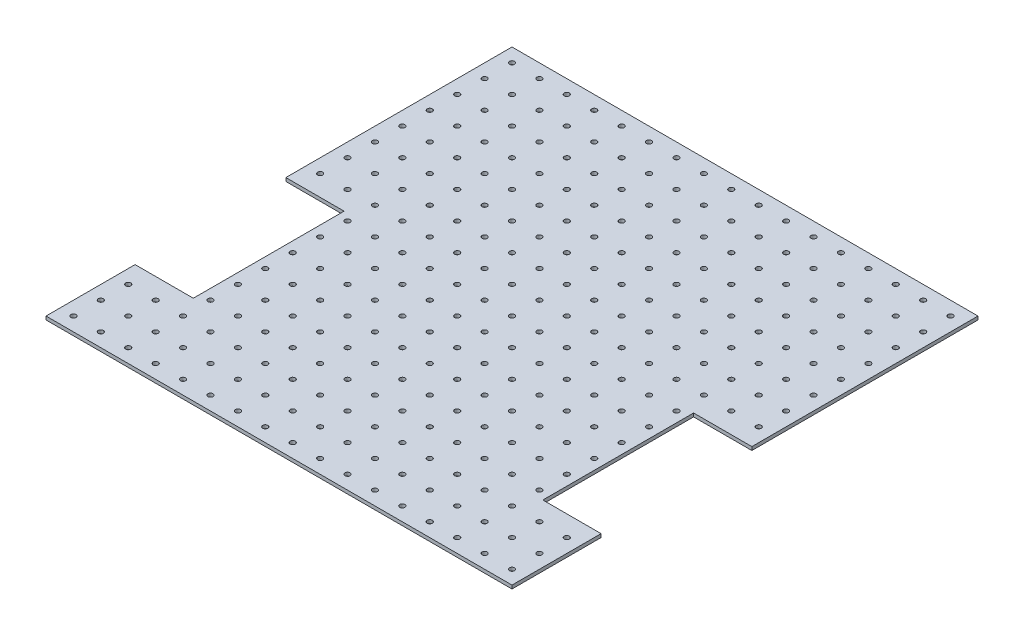
from build123d import *

# Parameters (mm, degrees)
SKETCH1_W           = 431.8
SKETCH1_H           = 431.8
BOSS_EXTRUDE1_DEPTH = 3.175
SKETCH2_R           = 2.38125
CUT_EXTRUDE1_DEPTH  = 3.175
SKETCH3_W           = 107.95
SKETCH3_H           = 139.7
CUT_EXTRUDE2_DEPTH  = 306.345215494


with BuildPart() as part:
    # Sketch1 → Boss-Extrude1 (new body)
    with BuildSketch(Plane(origin=(0, 0, 0), x_dir=(1, 0, 0), z_dir=(0, 1, 0))):
        Rectangle(SKETCH1_W, SKETCH1_H)
    extrude(amount=BOSS_EXTRUDE1_DEPTH)

    # Sketch2 → Cut-Extrude1 (cut)
    with BuildSketch(Plane(origin=(0, 3.175, 0), x_dir=(1, 0, 0), z_dir=(0, 1, 0))):
        with Locations((-203.2, -203.2)):
            Circle(SKETCH2_R)
        with Locations((-177.8, -203.2)):
            Circle(SKETCH2_R)
        with Locations((-152.4, -203.2)):
            Circle(SKETCH2_R)
        with Locations((-127, -203.2)):
            Circle(SKETCH2_R)
        with Locations((-101.6, -203.2)):
            Circle(SKETCH2_R)
        with Locations((-76.2, -203.2)):
            Circle(SKETCH2_R)
        with Locations((-50.8, -203.2)):
            Circle(SKETCH2_R)
        with Locations((-25.4, -203.2)):
            Circle(SKETCH2_R)
        with Locations((0, -203.2)):
            Circle(SKETCH2_R)
        with Locations((25.4, -203.2)):
            Circle(SKETCH2_R)
        with Locations((50.8, -203.2)):
            Circle(SKETCH2_R)
        with Locations((76.2, -203.2)):
            Circle(SKETCH2_R)
        with Locations((101.6, -203.2)):
            Circle(SKETCH2_R)
        with Locations((127, -203.2)):
            Circle(SKETCH2_R)
        with Locations((152.4, -203.2)):
            Circle(SKETCH2_R)
        with Locations((177.8, -203.2)):
            Circle(SKETCH2_R)
        with Locations((-177.8, -177.8)):
            Circle(SKETCH2_R)
        with Locations((-152.4, -177.8)):
            Circle(SKETCH2_R)
        with Locations((-127, -177.8)):
            Circle(SKETCH2_R)
        with Locations((-101.6, -177.8)):
            Circle(SKETCH2_R)
        with Locations((-76.2, -177.8)):
            Circle(SKETCH2_R)
        with Locations((-50.8, -177.8)):
            Circle(SKETCH2_R)
        with Locations((-25.4, -177.8)):
            Circle(SKETCH2_R)
        with Locations((0, -177.8)):
            Circle(SKETCH2_R)
        with Locations((25.4, -177.8)):
            Circle(SKETCH2_R)
        with Locations((50.8, -177.8)):
            Circle(SKETCH2_R)
        with Locations((76.2, -177.8)):
            Circle(SKETCH2_R)
        with Locations((101.6, -177.8)):
            Circle(SKETCH2_R)
        with Locations((127, -177.8)):
            Circle(SKETCH2_R)
        with Locations((152.4, -177.8)):
            Circle(SKETCH2_R)
        with Locations((177.8, -177.8)):
            Circle(SKETCH2_R)
        with Locations((-177.8, -152.4)):
            Circle(SKETCH2_R)
        with Locations((-152.4, -152.4)):
            Circle(SKETCH2_R)
        with Locations((-127, -152.4)):
            Circle(SKETCH2_R)
        with Locations((-101.6, -152.4)):
            Circle(SKETCH2_R)
        with Locations((-76.2, -152.4)):
            Circle(SKETCH2_R)
        with Locations((-50.8, -152.4)):
            Circle(SKETCH2_R)
        with Locations((-25.4, -152.4)):
            Circle(SKETCH2_R)
        with Locations((0, -152.4)):
            Circle(SKETCH2_R)
        with Locations((25.4, -152.4)):
            Circle(SKETCH2_R)
        with Locations((50.8, -152.4)):
            Circle(SKETCH2_R)
        with Locations((76.2, -152.4)):
            Circle(SKETCH2_R)
        with Locations((101.6, -152.4)):
            Circle(SKETCH2_R)
        with Locations((127, -152.4)):
            Circle(SKETCH2_R)
        with Locations((152.4, -152.4)):
            Circle(SKETCH2_R)
        with Locations((177.8, -152.4)):
            Circle(SKETCH2_R)
        with Locations((-177.8, -127)):
            Circle(SKETCH2_R)
        with Locations((-152.4, -127)):
            Circle(SKETCH2_R)
        with Locations((-127, -127)):
            Circle(SKETCH2_R)
        with Locations((-101.6, -127)):
            Circle(SKETCH2_R)
        with Locations((-76.2, -127)):
            Circle(SKETCH2_R)
        with Locations((-50.8, -127)):
            Circle(SKETCH2_R)
        with Locations((-25.4, -127)):
            Circle(SKETCH2_R)
        with Locations((0, -127)):
            Circle(SKETCH2_R)
        with Locations((25.4, -127)):
            Circle(SKETCH2_R)
        with Locations((50.8, -127)):
            Circle(SKETCH2_R)
        with Locations((76.2, -127)):
            Circle(SKETCH2_R)
        with Locations((101.6, -127)):
            Circle(SKETCH2_R)
        with Locations((127, -127)):
            Circle(SKETCH2_R)
        with Locations((152.4, -127)):
            Circle(SKETCH2_R)
        with Locations((177.8, -127)):
            Circle(SKETCH2_R)
        with Locations((-177.8, -101.6)):
            Circle(SKETCH2_R)
        with Locations((-152.4, -101.6)):
            Circle(SKETCH2_R)
        with Locations((-127, -101.6)):
            Circle(SKETCH2_R)
        with Locations((-101.6, -101.6)):
            Circle(SKETCH2_R)
        with Locations((-76.2, -101.6)):
            Circle(SKETCH2_R)
        with Locations((-50.8, -101.6)):
            Circle(SKETCH2_R)
        with Locations((-25.4, -101.6)):
            Circle(SKETCH2_R)
        with Locations((0, -101.6)):
            Circle(SKETCH2_R)
        with Locations((25.4, -101.6)):
            Circle(SKETCH2_R)
        with Locations((50.8, -101.6)):
            Circle(SKETCH2_R)
        with Locations((76.2, -101.6)):
            Circle(SKETCH2_R)
        with Locations((101.6, -101.6)):
            Circle(SKETCH2_R)
        with Locations((127, -101.6)):
            Circle(SKETCH2_R)
        with Locations((152.4, -101.6)):
            Circle(SKETCH2_R)
        with Locations((177.8, -101.6)):
            Circle(SKETCH2_R)
        with Locations((-177.8, -76.2)):
            Circle(SKETCH2_R)
        with Locations((-152.4, -76.2)):
            Circle(SKETCH2_R)
        with Locations((-127, -76.2)):
            Circle(SKETCH2_R)
        with Locations((-101.6, -76.2)):
            Circle(SKETCH2_R)
        with Locations((-76.2, -76.2)):
            Circle(SKETCH2_R)
        with Locations((-50.8, -76.2)):
            Circle(SKETCH2_R)
        with Locations((-25.4, -76.2)):
            Circle(SKETCH2_R)
        with Locations((0, -76.2)):
            Circle(SKETCH2_R)
        with Locations((25.4, -76.2)):
            Circle(SKETCH2_R)
        with Locations((50.8, -76.2)):
            Circle(SKETCH2_R)
        with Locations((76.2, -76.2)):
            Circle(SKETCH2_R)
        with Locations((101.6, -76.2)):
            Circle(SKETCH2_R)
        with Locations((127, -76.2)):
            Circle(SKETCH2_R)
        with Locations((152.4, -76.2)):
            Circle(SKETCH2_R)
        with Locations((177.8, -76.2)):
            Circle(SKETCH2_R)
        with Locations((-177.8, -50.8)):
            Circle(SKETCH2_R)
        with Locations((-152.4, -50.8)):
            Circle(SKETCH2_R)
        with Locations((-127, -50.8)):
            Circle(SKETCH2_R)
        with Locations((-101.6, -50.8)):
            Circle(SKETCH2_R)
        with Locations((-76.2, -50.8)):
            Circle(SKETCH2_R)
        with Locations((-50.8, -50.8)):
            Circle(SKETCH2_R)
        with Locations((-25.4, -50.8)):
            Circle(SKETCH2_R)
        with Locations((0, -50.8)):
            Circle(SKETCH2_R)
        with Locations((25.4, -50.8)):
            Circle(SKETCH2_R)
        with Locations((50.8, -50.8)):
            Circle(SKETCH2_R)
        with Locations((76.2, -50.8)):
            Circle(SKETCH2_R)
        with Locations((101.6, -50.8)):
            Circle(SKETCH2_R)
        with Locations((127, -50.8)):
            Circle(SKETCH2_R)
        with Locations((152.4, -50.8)):
            Circle(SKETCH2_R)
        with Locations((177.8, -50.8)):
            Circle(SKETCH2_R)
        with Locations((-177.8, -25.4)):
            Circle(SKETCH2_R)
        with Locations((-152.4, -25.4)):
            Circle(SKETCH2_R)
        with Locations((-127, -25.4)):
            Circle(SKETCH2_R)
        with Locations((-101.6, -25.4)):
            Circle(SKETCH2_R)
        with Locations((-76.2, -25.4)):
            Circle(SKETCH2_R)
        with Locations((-50.8, -25.4)):
            Circle(SKETCH2_R)
        with Locations((-25.4, -25.4)):
            Circle(SKETCH2_R)
        with Locations((0, -25.4)):
            Circle(SKETCH2_R)
        with Locations((25.4, -25.4)):
            Circle(SKETCH2_R)
        with Locations((50.8, -25.4)):
            Circle(SKETCH2_R)
        with Locations((76.2, -25.4)):
            Circle(SKETCH2_R)
        with Locations((101.6, -25.4)):
            Circle(SKETCH2_R)
        with Locations((127, -25.4)):
            Circle(SKETCH2_R)
        with Locations((152.4, -25.4)):
            Circle(SKETCH2_R)
        with Locations((177.8, -25.4)):
            Circle(SKETCH2_R)
        with Locations((-177.8, 0)):
            Circle(SKETCH2_R)
        with Locations((-152.4, 0)):
            Circle(SKETCH2_R)
        with Locations((-127, 0)):
            Circle(SKETCH2_R)
        with Locations((-101.6, 0)):
            Circle(SKETCH2_R)
        with Locations((-76.2, 0)):
            Circle(SKETCH2_R)
        with Locations((-50.8, 0)):
            Circle(SKETCH2_R)
        with Locations((-25.4, 0)):
            Circle(SKETCH2_R)
        Circle(SKETCH2_R)
        with Locations((25.4, 0)):
            Circle(SKETCH2_R)
        with Locations((50.8, 0)):
            Circle(SKETCH2_R)
        with Locations((76.2, 0)):
            Circle(SKETCH2_R)
        with Locations((101.6, 0)):
            Circle(SKETCH2_R)
        with Locations((127, 0)):
            Circle(SKETCH2_R)
        with Locations((152.4, 0)):
            Circle(SKETCH2_R)
        with Locations((177.8, 0)):
            Circle(SKETCH2_R)
        with Locations((-177.8, 25.4)):
            Circle(SKETCH2_R)
        with Locations((-152.4, 25.4)):
            Circle(SKETCH2_R)
        with Locations((-127, 25.4)):
            Circle(SKETCH2_R)
        with Locations((-101.6, 25.4)):
            Circle(SKETCH2_R)
        with Locations((-76.2, 25.4)):
            Circle(SKETCH2_R)
        with Locations((-50.8, 25.4)):
            Circle(SKETCH2_R)
        with Locations((-25.4, 25.4)):
            Circle(SKETCH2_R)
        with Locations((0, 25.4)):
            Circle(SKETCH2_R)
        with Locations((25.4, 25.4)):
            Circle(SKETCH2_R)
        with Locations((50.8, 25.4)):
            Circle(SKETCH2_R)
        with Locations((76.2, 25.4)):
            Circle(SKETCH2_R)
        with Locations((101.6, 25.4)):
            Circle(SKETCH2_R)
        with Locations((127, 25.4)):
            Circle(SKETCH2_R)
        with Locations((152.4, 25.4)):
            Circle(SKETCH2_R)
        with Locations((177.8, 25.4)):
            Circle(SKETCH2_R)
        with Locations((-177.8, 50.8)):
            Circle(SKETCH2_R)
        with Locations((-152.4, 50.8)):
            Circle(SKETCH2_R)
        with Locations((-127, 50.8)):
            Circle(SKETCH2_R)
        with Locations((-101.6, 50.8)):
            Circle(SKETCH2_R)
        with Locations((-76.2, 50.8)):
            Circle(SKETCH2_R)
        with Locations((-50.8, 50.8)):
            Circle(SKETCH2_R)
        with Locations((-25.4, 50.8)):
            Circle(SKETCH2_R)
        with Locations((0, 50.8)):
            Circle(SKETCH2_R)
        with Locations((25.4, 50.8)):
            Circle(SKETCH2_R)
        with Locations((50.8, 50.8)):
            Circle(SKETCH2_R)
        with Locations((76.2, 50.8)):
            Circle(SKETCH2_R)
        with Locations((101.6, 50.8)):
            Circle(SKETCH2_R)
        with Locations((127, 50.8)):
            Circle(SKETCH2_R)
        with Locations((152.4, 50.8)):
            Circle(SKETCH2_R)
        with Locations((177.8, 50.8)):
            Circle(SKETCH2_R)
        with Locations((-177.8, 76.2)):
            Circle(SKETCH2_R)
        with Locations((-152.4, 76.2)):
            Circle(SKETCH2_R)
        with Locations((-127, 76.2)):
            Circle(SKETCH2_R)
        with Locations((-101.6, 76.2)):
            Circle(SKETCH2_R)
        with Locations((-76.2, 76.2)):
            Circle(SKETCH2_R)
        with Locations((-50.8, 76.2)):
            Circle(SKETCH2_R)
        with Locations((-25.4, 76.2)):
            Circle(SKETCH2_R)
        with Locations((0, 76.2)):
            Circle(SKETCH2_R)
        with Locations((25.4, 76.2)):
            Circle(SKETCH2_R)
        with Locations((50.8, 76.2)):
            Circle(SKETCH2_R)
        with Locations((76.2, 76.2)):
            Circle(SKETCH2_R)
        with Locations((101.6, 76.2)):
            Circle(SKETCH2_R)
        with Locations((127, 76.2)):
            Circle(SKETCH2_R)
        with Locations((152.4, 76.2)):
            Circle(SKETCH2_R)
        with Locations((177.8, 76.2)):
            Circle(SKETCH2_R)
        with Locations((-177.8, 101.6)):
            Circle(SKETCH2_R)
        with Locations((-152.4, 101.6)):
            Circle(SKETCH2_R)
        with Locations((-127, 101.6)):
            Circle(SKETCH2_R)
        with Locations((-101.6, 101.6)):
            Circle(SKETCH2_R)
        with Locations((-76.2, 101.6)):
            Circle(SKETCH2_R)
        with Locations((-50.8, 101.6)):
            Circle(SKETCH2_R)
        with Locations((-25.4, 101.6)):
            Circle(SKETCH2_R)
        with Locations((0, 101.6)):
            Circle(SKETCH2_R)
        with Locations((25.4, 101.6)):
            Circle(SKETCH2_R)
        with Locations((50.8, 101.6)):
            Circle(SKETCH2_R)
        with Locations((76.2, 101.6)):
            Circle(SKETCH2_R)
        with Locations((101.6, 101.6)):
            Circle(SKETCH2_R)
        with Locations((127, 101.6)):
            Circle(SKETCH2_R)
        with Locations((152.4, 101.6)):
            Circle(SKETCH2_R)
        with Locations((177.8, 101.6)):
            Circle(SKETCH2_R)
        with Locations((-177.8, 127)):
            Circle(SKETCH2_R)
        with Locations((-152.4, 127)):
            Circle(SKETCH2_R)
        with Locations((-127, 127)):
            Circle(SKETCH2_R)
        with Locations((-101.6, 127)):
            Circle(SKETCH2_R)
        with Locations((-76.2, 127)):
            Circle(SKETCH2_R)
        with Locations((-50.8, 127)):
            Circle(SKETCH2_R)
        with Locations((-25.4, 127)):
            Circle(SKETCH2_R)
        with Locations((0, 127)):
            Circle(SKETCH2_R)
        with Locations((25.4, 127)):
            Circle(SKETCH2_R)
        with Locations((50.8, 127)):
            Circle(SKETCH2_R)
        with Locations((76.2, 127)):
            Circle(SKETCH2_R)
        with Locations((101.6, 127)):
            Circle(SKETCH2_R)
        with Locations((127, 127)):
            Circle(SKETCH2_R)
        with Locations((152.4, 127)):
            Circle(SKETCH2_R)
        with Locations((177.8, 127)):
            Circle(SKETCH2_R)
        with Locations((-177.8, 152.4)):
            Circle(SKETCH2_R)
        with Locations((-152.4, 152.4)):
            Circle(SKETCH2_R)
        with Locations((-127, 152.4)):
            Circle(SKETCH2_R)
        with Locations((-101.6, 152.4)):
            Circle(SKETCH2_R)
        with Locations((-76.2, 152.4)):
            Circle(SKETCH2_R)
        with Locations((-50.8, 152.4)):
            Circle(SKETCH2_R)
        with Locations((-25.4, 152.4)):
            Circle(SKETCH2_R)
        with Locations((0, 152.4)):
            Circle(SKETCH2_R)
        with Locations((25.4, 152.4)):
            Circle(SKETCH2_R)
        with Locations((50.8, 152.4)):
            Circle(SKETCH2_R)
        with Locations((76.2, 152.4)):
            Circle(SKETCH2_R)
        with Locations((101.6, 152.4)):
            Circle(SKETCH2_R)
        with Locations((127, 152.4)):
            Circle(SKETCH2_R)
        with Locations((152.4, 152.4)):
            Circle(SKETCH2_R)
        with Locations((177.8, 152.4)):
            Circle(SKETCH2_R)
        with Locations((-177.8, 177.8)):
            Circle(SKETCH2_R)
        with Locations((-152.4, 177.8)):
            Circle(SKETCH2_R)
        with Locations((-127, 177.8)):
            Circle(SKETCH2_R)
        with Locations((-101.6, 177.8)):
            Circle(SKETCH2_R)
        with Locations((-76.2, 177.8)):
            Circle(SKETCH2_R)
        with Locations((-50.8, 177.8)):
            Circle(SKETCH2_R)
        with Locations((-25.4, 177.8)):
            Circle(SKETCH2_R)
        with Locations((0, 177.8)):
            Circle(SKETCH2_R)
        with Locations((25.4, 177.8)):
            Circle(SKETCH2_R)
        with Locations((50.8, 177.8)):
            Circle(SKETCH2_R)
        with Locations((76.2, 177.8)):
            Circle(SKETCH2_R)
        with Locations((101.6, 177.8)):
            Circle(SKETCH2_R)
        with Locations((127, 177.8)):
            Circle(SKETCH2_R)
        with Locations((152.4, 177.8)):
            Circle(SKETCH2_R)
        with Locations((177.8, 177.8)):
            Circle(SKETCH2_R)
        with Locations((-203.2, -177.8)):
            Circle(SKETCH2_R)
        with Locations((-203.2, -152.4)):
            Circle(SKETCH2_R)
        with Locations((-203.2, -127)):
            Circle(SKETCH2_R)
        with Locations((-203.2, -101.6)):
            Circle(SKETCH2_R)
        with Locations((-203.2, -76.2)):
            Circle(SKETCH2_R)
        with Locations((-203.2, -50.8)):
            Circle(SKETCH2_R)
        with Locations((-203.2, -25.4)):
            Circle(SKETCH2_R)
        with Locations((-203.2, 0)):
            Circle(SKETCH2_R)
        with Locations((-203.2, 25.4)):
            Circle(SKETCH2_R)
        with Locations((-203.2, 50.8)):
            Circle(SKETCH2_R)
        with Locations((-203.2, 76.2)):
            Circle(SKETCH2_R)
        with Locations((-203.2, 101.6)):
            Circle(SKETCH2_R)
        with Locations((-203.2, 127)):
            Circle(SKETCH2_R)
        with Locations((-203.2, 152.4)):
            Circle(SKETCH2_R)
        with Locations((-203.2, 177.8)):
            Circle(SKETCH2_R)
        with Locations((203.2, -203.2)):
            Circle(SKETCH2_R)
        with Locations((203.2, -177.8)):
            Circle(SKETCH2_R)
        with Locations((203.2, -152.4)):
            Circle(SKETCH2_R)
        with Locations((203.2, -127)):
            Circle(SKETCH2_R)
        with Locations((203.2, -101.6)):
            Circle(SKETCH2_R)
        with Locations((203.2, -76.2)):
            Circle(SKETCH2_R)
        with Locations((203.2, -50.8)):
            Circle(SKETCH2_R)
        with Locations((203.2, -25.4)):
            Circle(SKETCH2_R)
        with Locations((203.2, 0)):
            Circle(SKETCH2_R)
        with Locations((203.2, 25.4)):
            Circle(SKETCH2_R)
        with Locations((203.2, 50.8)):
            Circle(SKETCH2_R)
        with Locations((203.2, 76.2)):
            Circle(SKETCH2_R)
        with Locations((203.2, 101.6)):
            Circle(SKETCH2_R)
        with Locations((203.2, 127)):
            Circle(SKETCH2_R)
        with Locations((203.2, 152.4)):
            Circle(SKETCH2_R)
        with Locations((203.2, 177.8)):
            Circle(SKETCH2_R)
        with Locations((-203.2, 203.2)):
            Circle(SKETCH2_R)
        with Locations((-177.8, 203.2)):
            Circle(SKETCH2_R)
        with Locations((-152.4, 203.2)):
            Circle(SKETCH2_R)
        with Locations((-127, 203.2)):
            Circle(SKETCH2_R)
        with Locations((-101.6, 203.2)):
            Circle(SKETCH2_R)
        with Locations((-76.2, 203.2)):
            Circle(SKETCH2_R)
        with Locations((-50.8, 203.2)):
            Circle(SKETCH2_R)
        with Locations((-25.4, 203.2)):
            Circle(SKETCH2_R)
        with Locations((0, 203.2)):
            Circle(SKETCH2_R)
        with Locations((25.4, 203.2)):
            Circle(SKETCH2_R)
        with Locations((50.8, 203.2)):
            Circle(SKETCH2_R)
        with Locations((76.2, 203.2)):
            Circle(SKETCH2_R)
        with Locations((101.6, 203.2)):
            Circle(SKETCH2_R)
        with Locations((127, 203.2)):
            Circle(SKETCH2_R)
        with Locations((152.4, 203.2)):
            Circle(SKETCH2_R)
        with Locations((177.8, 203.2)):
            Circle(SKETCH2_R)
        with Locations((203.2, 203.2)):
            Circle(SKETCH2_R)
    extrude(amount=-CUT_EXTRUDE1_DEPTH, mode=Mode.SUBTRACT)

    # Sketch3 → Cut-Extrude2 (cut, through all)
    with BuildSketch(Plane(origin=(0, 3.175, 0), x_dir=(1, 0, 0), z_dir=(0, 1, 0))):
        with Locations((-215.9, -63.5)):
            Rectangle(SKETCH3_W, SKETCH3_H)
    cut_extrude2 = extrude(amount=-CUT_EXTRUDE2_DEPTH, mode=Mode.SUBTRACT)

    # Mirror1: Cut-Extrude2 across plane
    add(cut_extrude2.mirror(Plane(origin=(0, 0, 0), x_dir=(0, 0, 1), z_dir=(1, 0, 0))), mode=Mode.SUBTRACT)


solid = part.part
